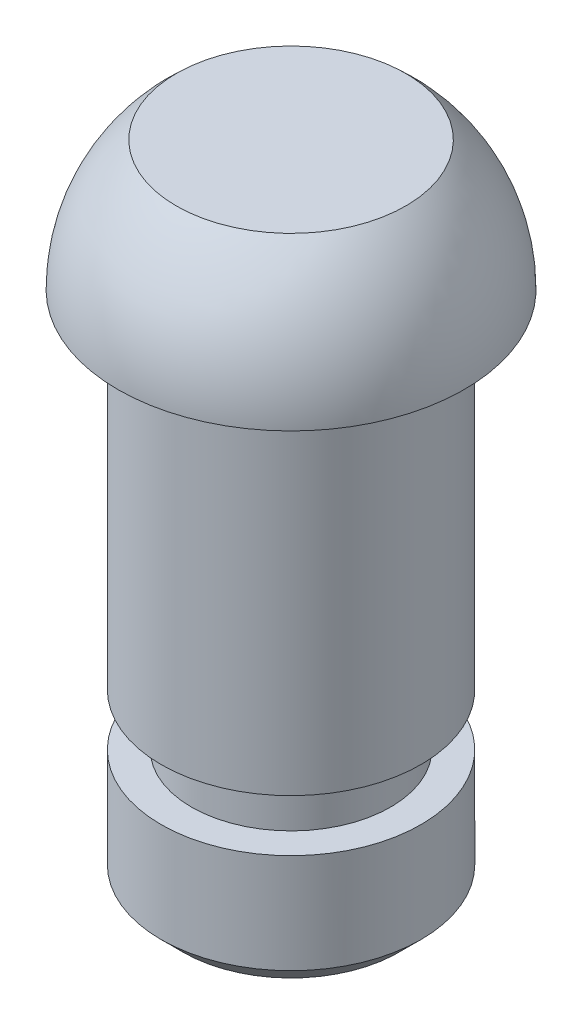
from build123d import *

# Parameters (mm, degrees)
CHAMFER1_SIZE = 0.25


with BuildPart() as part:
    # Sketch1 → Revolve1 (revolve)
    with BuildSketch(Plane.XY):
        with BuildLine():
            Line((-1.325, 2.76692963), (0, 2.76692963))
            Line((0, 2.76692963), (0, -4.731194196))
            Line((0, -4.731194196), (-1.5, -4.731194196))
            Line((-1.5, -4.731194196), (-1.5, -3.331194196))
            Line((-1.5, -3.331194196), (-1.15, -3.331194196))
            Line((-1.15, -3.331194196), (-1.15, -2.731194196))
            Line((-1.15, -2.731194196), (-1.5, -2.731194196))
            Line((-1.5, -2.731194196), (-1.5, 1.268805804))
            Line((-1.5, 1.268805804), (-2, 1.268805804))
            ThreePointArc((-2, 1.268805804), (-1.823458253, 2.09038964), (-1.325, 2.76692963))
        make_face()
    revolve(axis=Axis((0, 0, 0), (0, -1, 0)))

    # Chamfer1
    chamfer1_edges = [part.edges().sort_by_distance(p)[0] for p in [
        (1.5, -4.731194196, 0),
    ]]
    chamfer(chamfer1_edges, length=CHAMFER1_SIZE)


solid = part.part
